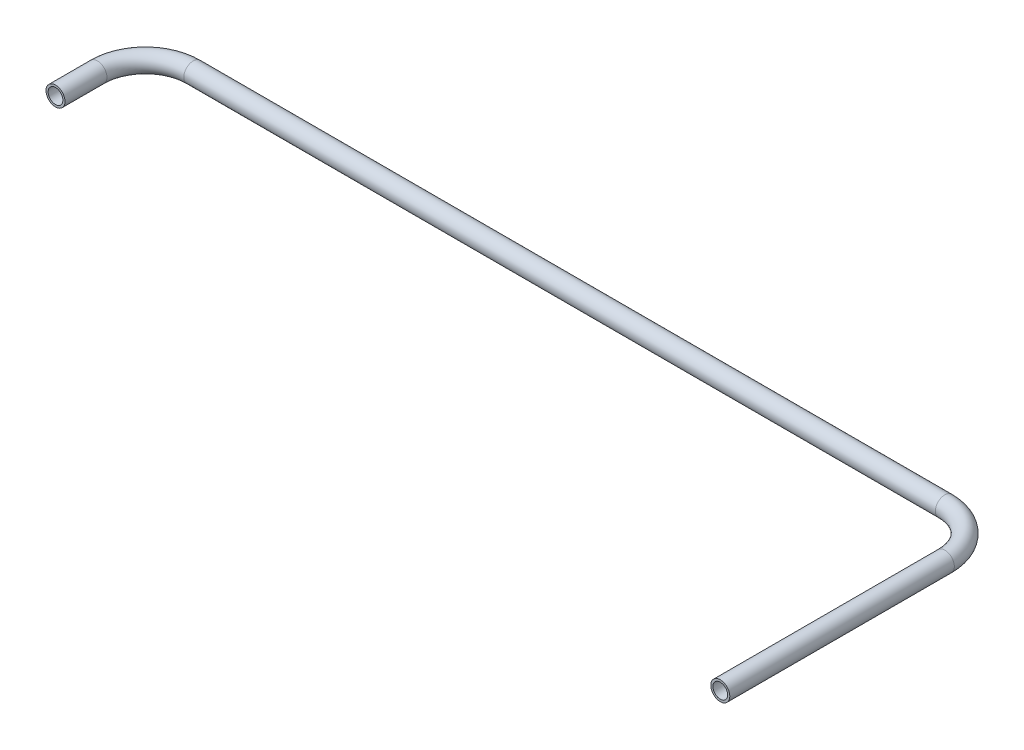
from build123d import *

# Parameters (mm, degrees)
SKETCH2_R   = 3.175
SKETCH2_R_2 = 2.4638


with BuildPart() as part:
    # Sweep-Thin1: sweep along a path in Sketch1
    with BuildLine(Plane(origin=(0, 0, 0), x_dir=(1, 0, 0), z_dir=(0, 1, 0))) as sweep_thin1_path:
        Line((0, 0), (0, 14))
        ThreePointArc((0, 14), (4.686291501, 25.313708499), (16, 30))
        Line((16, 30), (267, 30))
        ThreePointArc((267, 30), (278.313708499, 25.313708499), (283, 14))
        Line((283, 14), (283, -61))
    # Sketch2 → Sweep-Thin1 (sweep)
    with BuildSketch(Plane.XY):
        Circle(SKETCH2_R)
        Circle(SKETCH2_R_2, mode=Mode.SUBTRACT)
    sweep(path=sweep_thin1_path.line)


solid = part.part
